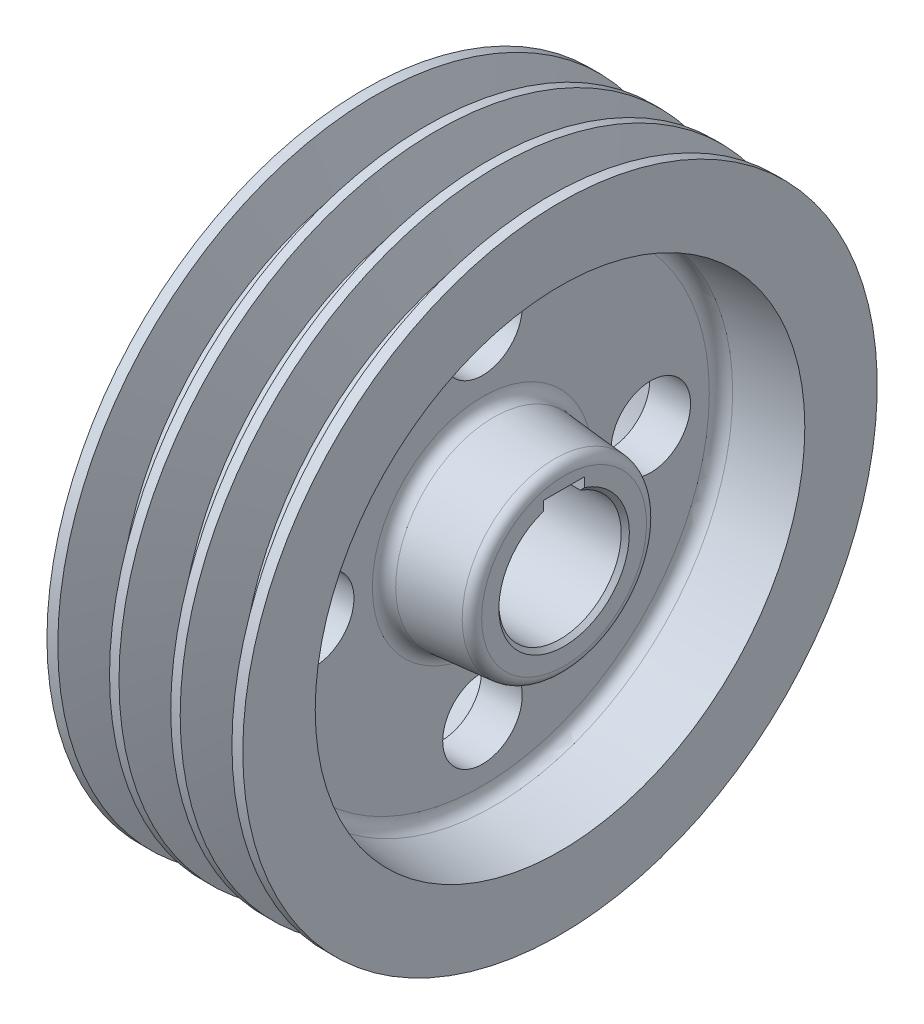
from build123d import *

# Parameters (mm, degrees)
PATTERN_LINEAR_986_COUNT    = 3
PATTERN_LINEAR_986_PITCH    = 15
CHAMFER_1_SIZE              = 1
SKETCH_4_W                  = 10
SKETCH_4_H                  = 3.357864376
CUT_EXTRUDE_1_DEPTH         = 121.789589783
FILLET_1_R                  = 3
FILLET_2_R                  = 2.5
SKETCH_5_R                  = 9.75
CUT_EXTRUDE_2_DEPTH         = 121.379088716
PATTERN_CIRCULAR_1971_COUNT = 4


with BuildPart() as part:
    # 草图1 → 旋转1 (revolve)
    with BuildSketch(Plane.XY):
        Polygon((-1, 15), (-1, 22.5), (19, 24.249773271), (19, 58.337715393), (0, 60), (0, 77.75), (48, 77.75), (48, 60), (29, 58.337715393), (29, 24.249773271), (49, 22.5), (49, 15), align=None)
    revolve(axis=Axis((0, 0, 0), (1, 0, 0)))

    # 草图2 → 切除-旋转1 (revolve, cut)
    with BuildSketch(Plane.XY):
        Polygon((11.840143071, 66.3), (15.340759374, 77.75), (2.659240626, 77.75), (6.159856929, 66.3), align=None)
    cut_revolve_1 = revolve(axis=Axis((0, 0, 0), (1, 0, 0)), mode=Mode.SUBTRACT)

    # Pattern Linear 986: 切除-旋转1 ×3
    with Locations(*[(i * PATTERN_LINEAR_986_PITCH, 0, 0) for i in range(1, PATTERN_LINEAR_986_COUNT)]):
        add(cut_revolve_1, mode=Mode.SUBTRACT)

    # 倒角1
    chamfer_1_edges = [part.edges().sort_by_distance(p)[0] for p in [
        (-1, -15, 0),
        (49, -15, 0),
    ]]
    chamfer(chamfer_1_edges, length=CHAMFER_1_SIZE)

    # 草图4 → 切除-拉伸1 (cut, through all)
    with BuildSketch(Plane.ZY.offset(1)):
        with Locations((0, 15.821067812)):
            Rectangle(SKETCH_4_W, SKETCH_4_H)
    extrude(amount=-CUT_EXTRUDE_1_DEPTH, mode=Mode.SUBTRACT)

    # 圆角1
    fillet_1_edges = [part.edges().sort_by_distance(p)[0] for p in [
        (29, -58.337715393, 0),
        (19, -24.249773271, 0),
        (19, -58.337715393, 0),
        (29, -24.249773271, 0),
    ]]
    fillet(fillet_1_edges, radius=FILLET_1_R)

    # 圆角2
    fillet_2_edges = [part.edges().sort_by_distance(p)[0] for p in [
        (49, -22.5, 0),
        (-1, -22.5, 0),
    ]]
    fillet(fillet_2_edges, radius=FILLET_2_R)

    # 草图5 → 切除-拉伸2 (cut, through all)
    with BuildSketch(Plane(origin=(0, 0, 0), x_dir=(0, 0, -1), z_dir=(1, 0, 0))):
        with Locations((0, 41.25)):
            Circle(SKETCH_5_R)
    cut_extrude_2 = extrude(amount=CUT_EXTRUDE_2_DEPTH, mode=Mode.SUBTRACT)

    # Pattern Circular 1971: 切除-拉伸2 ×4 about axis
    pattern_circular_1971_axis = Axis((0, 0, 0), (-1, 0, 0))
    for i in range(1, PATTERN_CIRCULAR_1971_COUNT):
        add(cut_extrude_2.rotate(pattern_circular_1971_axis, i * 360 / PATTERN_CIRCULAR_1971_COUNT), mode=Mode.SUBTRACT)


solid = part.part
